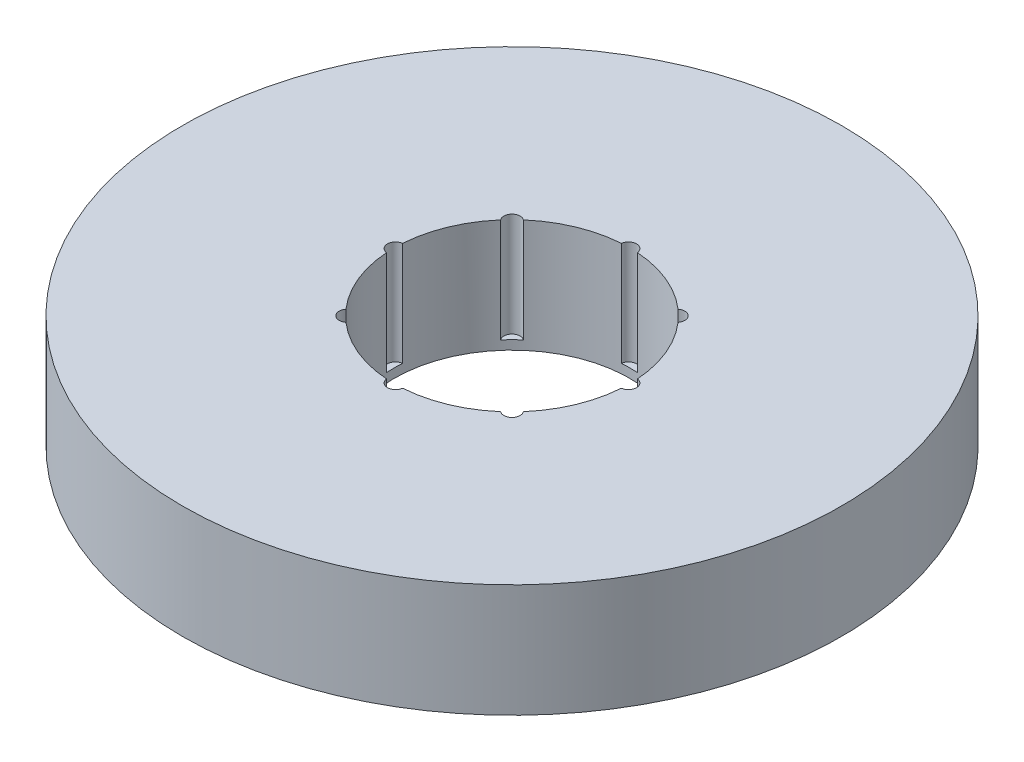
from build123d import *

# Parameters (mm, degrees)
SKETCH1_R           = 70
BOSS_EXTRUDE1_DEPTH = 24
SKETCH2_R           = 25
CUT_EXTRUDE1_DEPTH  = 102.862652626
SKETCH3_R           = 1.722060104
CUT_EXTRUDE2_DEPTH  = 22.07671081
CIRPATTERN1_COUNT   = 8


with BuildPart() as part:
    # Sketch1 → Boss-Extrude1 (new body)
    with BuildSketch(Plane(origin=(0, 0, 0), x_dir=(1, 0, 0), z_dir=(0, 1, 0))):
        Circle(SKETCH1_R)
    extrude(amount=BOSS_EXTRUDE1_DEPTH)

    # Sketch2 → Cut-Extrude1 (cut, through all)
    with BuildSketch(Plane(origin=(0, 0, 0), x_dir=(1, 0, 0), z_dir=(0, 1, 0))):
        Circle(SKETCH2_R)
    extrude(amount=CUT_EXTRUDE1_DEPTH, mode=Mode.SUBTRACT)

    # Sketch3 → Cut-Extrude2 (cut)
    with BuildSketch(Plane(origin=(0, 24, 0), x_dir=(1, 0, 0), z_dir=(0, 1, 0))):
        with Locations((-24.735628463, 0)):
            Circle(SKETCH3_R)
    cut_extrude2 = extrude(amount=-CUT_EXTRUDE2_DEPTH, mode=Mode.SUBTRACT)

    # CirPattern1: Cut-Extrude2 ×8 about axis
    cirpattern1_axis = Axis((0, 0, 0), (0, 1, 0))
    for i in range(1, CIRPATTERN1_COUNT):
        add(cut_extrude2.rotate(cirpattern1_axis, i * 360 / CIRPATTERN1_COUNT), mode=Mode.SUBTRACT)


solid = part.part
